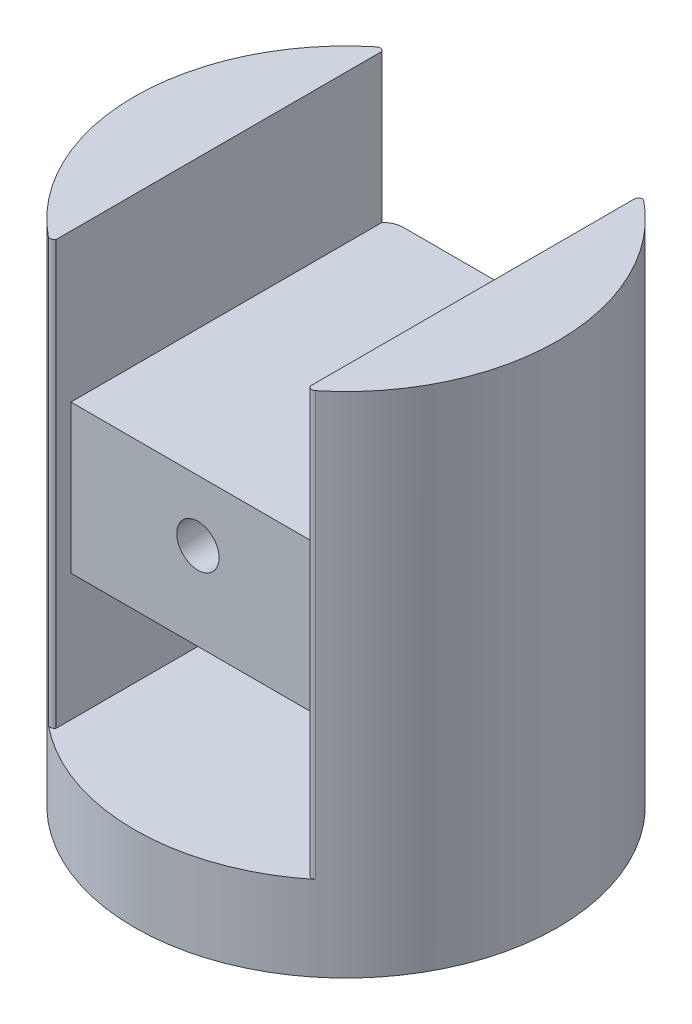
from build123d import *

# Parameters (mm, degrees)
SKETCH1_R           = 10
BOSS_EXTRUDE1_DEPTH = 4
BOSS_EXTRUDE2_DEPTH = 20
SKETCH6_W           = 12
SKETCH6_H           = 15
BOSS_EXTRUDE4_DEPTH = 3
SKETCH10_W          = 12
SKETCH10_H          = 15
BOSS_EXTRUDE5_DEPTH = 4
FILLET1_R           = 1
CUT_EXTRUDE3_REACH  = 33.064
SKETCH7_R           = 1


with BuildPart() as part:
    # Sketch1 → Boss-Extrude1 (new body)
    with BuildSketch(Plane(origin=(0, 0, 0), x_dir=(1, 0, 0), z_dir=(0, 1, 0))):
        with Locations(Location((0, 0, 0), (0, 0, 270))):
            Circle(SKETCH1_R)
    extrude(amount=BOSS_EXTRUDE1_DEPTH)

    # Sketch2 → Boss-Extrude2 (add)
    with BuildSketch(Plane(origin=(0, 4, 0), x_dir=(1, 0, 0), z_dir=(0, 1, 0))):
        with BuildLine():
            Line((-6, 7.7), (-6, -7.7))
            ThreePointArc((-6, -7.7), (-6.145446182, -7.798029265), (-6.315135994, -7.753648005))
            ThreePointArc((-6.315135994, -7.753648005), (-10, 0), (-6.315135994, 7.753648005))
            ThreePointArc((-6.315135994, 7.753648005), (-6.145446182, 7.798029265), (-6, 7.7))
        make_face()
        with BuildLine():
            Line((6, 7.6), (6, -7.7))
            ThreePointArc((6, -7.7), (6.145446182, -7.798029265), (6.315135994, -7.753648005))
            ThreePointArc((6.315135994, -7.753648005), (9.999874962, 0.050007502), (6.237272998, 7.816420251))
            ThreePointArc((6.237272998, 7.816420251), (6.069665116, 7.76190005), (6, 7.6))
        make_face()
    extrude(amount=BOSS_EXTRUDE2_DEPTH)

    # Sketch6 → Boss-Extrude4 (add)
    with BuildSketch(Plane(origin=(0, 14, 0), x_dir=(1, 0, 0), z_dir=(0, 1, 0))):
        with Locations((0, 0.5)):
            Rectangle(SKETCH6_W, SKETCH6_H)
    extrude(amount=BOSS_EXTRUDE4_DEPTH)

    # Sketch10 → Boss-Extrude5 (add)
    with BuildSketch(Plane.XZ.offset(-14)):
        with Locations((0, -0.5)):
            Rectangle(SKETCH10_W, SKETCH10_H)
    extrude(amount=BOSS_EXTRUDE5_DEPTH)

    # Fillet1
    # the kernel refuses this fillet: 1 mm, written as the material it takes off along each edge
    with BuildSketch(Plane(origin=(6, 14, -8), x_dir=(0, 0, 1), z_dir=(0, -1, 0))) as fillet1_piece_1_section:
        with BuildLine():
            CenterArc((1, 0.793964744), FILLET1_R, 180, 52.557582208)
            Line((0, 0.793964744), (-0.02, 0.793964744))
            Line((-0.02, 0.793964744), (-0.02, 0))
            Line((-0.02, 0), (0, -0.02))
            ThreePointArc((0, -0.02), (0.196018099, -0.02), (0.379876922, -0.015879295))
            Line((0.379876922, -0.015879295), (0.392036198, 0))
        make_face()
    fillet1_piece_1 = extrude(amount=5.984911861, mode=Mode.PRIVATE)
    fillet1_piece_1 = fillet1_piece_1 - Plane(origin=(6.213704622, 11.00754407, -7.603981901), x_dir=(0.11026568498271415, 0, -0.993902147454815), z_dir=(0, -1, 0)) * Cylinder(0.213741715, 16, mode=Mode.PRIVATE)
    add(fillet1_piece_1, mode=Mode.SUBTRACT)
    with BuildSketch(Plane(origin=(-6, 14, -8), x_dir=(0, 0, 1), z_dir=(0, -1, 0))) as fillet1_piece_2_section:
        with BuildLine():
            CenterArc((1, -0.714142843), FILLET1_R, 134.427004001, 45.572995999)
            Line((0, -0.714142843), (-0.02, -0.714142843))
            Line((-0.02, -0.714142843), (-0.02, 0))
            Line((-0.02, 0), (0, 0.02))
            ThreePointArc((0, 0.02), (0.15, 0.02), (0.286, 0.014282857))
            Line((0.286, 0.014282857), (0.3, 0))
        make_face()
    fillet1_piece_2 = extrude(amount=5.785357107, mode=Mode.PRIVATE)
    fillet1_piece_2 = fillet1_piece_2 - Plane(origin=(-6.181186106, 11.107321446, -7.588087879), x_dir=(-0.628985521858462, 0, -0.7774170137657384), z_dir=(0, -1, 0)) * Cylinder(0.212961798, 15, mode=Mode.PRIVATE)
    add(fillet1_piece_2, mode=Mode.SUBTRACT)
    with BuildSketch(Plane(origin=(-6, 14, -8), x_dir=(0, 0, 1), z_dir=(0, 1, 0))) as fillet1_piece_3_section:
        with BuildLine():
            CenterArc((1, 0.714142843), FILLET1_R, 180, 45.572995999)
            Line((0, 0.714142843), (-0.02, 0.714142843))
            Line((-0.02, 0.714142843), (-0.02, 0))
            Line((-0.02, 0), (0, -0.02))
            ThreePointArc((0, -0.02), (0.15, -0.02), (0.286, -0.014282857))
            Line((0.286, -0.014282857), (0.3, 0))
        make_face()
    fillet1_piece_3 = extrude(amount=4.785357107, mode=Mode.PRIVATE)
    fillet1_piece_3 = fillet1_piece_3 - Plane(origin=(-6.181186106, 16.392678554, -7.588087879), x_dir=(-0.628985521858462, 0, -0.7774170137657384), z_dir=(0, -1, 0)) * Cylinder(0.212961798, 13, mode=Mode.PRIVATE)
    add(fillet1_piece_3, mode=Mode.SUBTRACT)
    with BuildSketch(Plane(origin=(6, 14, -8), x_dir=(0, 0, 1), z_dir=(0, 1, 0))) as fillet1_piece_4_section:
        with BuildLine():
            CenterArc((1, -0.793964744), FILLET1_R, 127.442417792, 52.557582208)
            Line((0, -0.793964744), (-0.02, -0.793964744))
            Line((-0.02, -0.793964744), (-0.02, 0))
            Line((-0.02, 0), (0, 0.02))
            ThreePointArc((0, 0.02), (0.196018099, 0.02), (0.379876922, 0.015879295))
            Line((0.379876922, 0.015879295), (0.392036198, 0))
        make_face()
    fillet1_piece_4 = extrude(amount=4.984911861, mode=Mode.PRIVATE)
    fillet1_piece_4 = fillet1_piece_4 - Plane(origin=(6.213704622, 16.49245593, -7.603981901), x_dir=(0.11026568498271415, 0, -0.993902147454815), z_dir=(0, -1, 0)) * Cylinder(0.213741715, 14, mode=Mode.PRIVATE)
    add(fillet1_piece_4, mode=Mode.SUBTRACT)

    # Sketch7 → Cut-Extrude3 (cut, up to next)
    with BuildSketch(Plane.XY.offset(7), mode=Mode.PRIVATE) as cut_extrude3_sk1:
        with Locations((0, 14.12)):
            Circle(SKETCH7_R)
    cut_extrude3_tool1 = extrude(cut_extrude3_sk1.sketch, amount=-CUT_EXTRUDE3_REACH, mode=Mode.PRIVATE) & part.part
    add(cut_extrude3_tool1.solids().sort_by_distance((0, 14.12, 7))[0], mode=Mode.SUBTRACT)


solid = part.part
